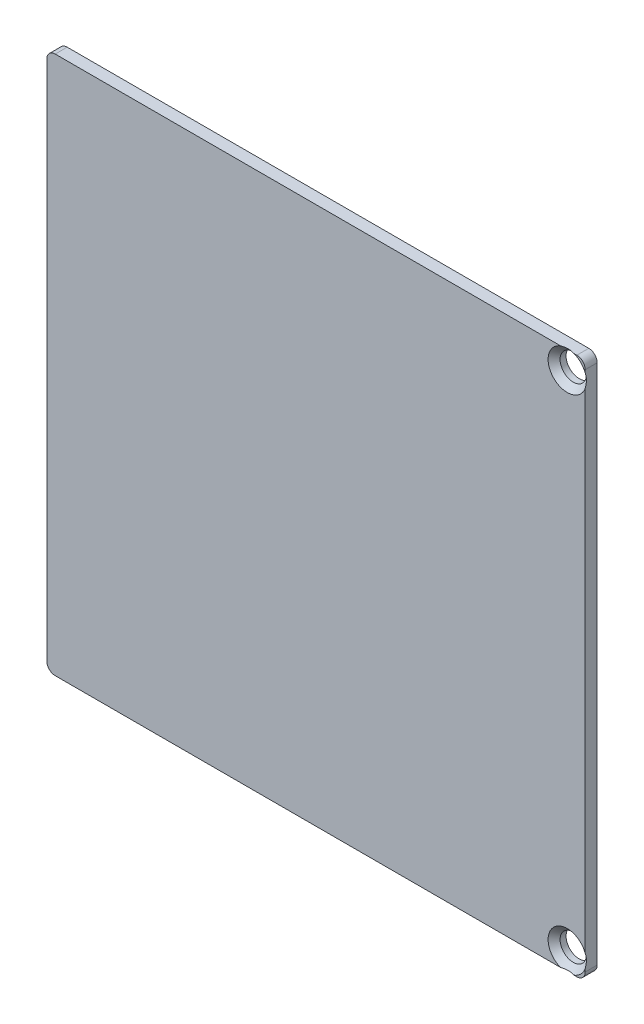
from build123d import *

# Parameters (mm, degrees)
EXTRUDE_1_DEPTH     = 1
SKETCH_2_W          = 2
SKETCH_2_H          = 29
EXTRUDE_2_DEPTH     = 7
SKETCH_3_R          = 1.1
CUT_EXTRUDE_1_DEPTH = 7
SKETCH_4_R          = 0.8
CUT_EXTRUDE_2_DEPTH = 7
CHAMFER_1_SIZE      = 0.5
FILLET_1_R          = 4
CUT_EXTRUDE_3_DEPTH = 10


with BuildPart() as part:
    # 草图1 → 凸台-拉伸1 (new body)
    with BuildSketch(Plane.XY):
        with BuildLine():
            Line((22.5, -21.8), (22.5, 21.8))
            ThreePointArc((22.5, 21.8), (22.294974747, 22.294974747), (21.8, 22.5))
            Line((21.8, 22.5), (-21.8, 22.5))
            ThreePointArc((-21.8, 22.5), (-22.294974747, 22.294974747), (-22.5, 21.8))
            Line((-22.5, 21.8), (-22.5, -21.8))
            ThreePointArc((-22.5, -21.8), (-22.294974747, -22.294974747), (-21.8, -22.5))
            Line((-21.8, -22.5), (21.8, -22.5))
            ThreePointArc((21.8, -22.5), (22.294974747, -22.294974747), (22.5, -21.8))
        make_face()
    extrude(amount=EXTRUDE_1_DEPTH)

    # 草图2 → 凸台-拉伸2 (add)
    with BuildSketch(Plane(origin=(0, 0, 0), x_dir=(-1, 0, 0), z_dir=(0, 0, -1))):
        with Locations((21.5, 0)):
            Rectangle(SKETCH_2_W, SKETCH_2_H)
    extrude(amount=EXTRUDE_2_DEPTH)

    # 草图3 → 切除-拉伸1 (cut)
    with BuildSketch(Plane(origin=(0, 0, 0), x_dir=(-1, 0, 0), z_dir=(0, 0, -1))):
        with Locations((-21, 21)):
            Circle(SKETCH_3_R)
        with Locations((-21, -21)):
            Circle(SKETCH_3_R)
    extrude(amount=-CUT_EXTRUDE_1_DEPTH, mode=Mode.SUBTRACT)

    # 草图4 → 切除-拉伸2 (cut)
    with BuildSketch(Plane.ZY.offset(22.5)):
        with Locations(Location((-3.5, 10, 0), (0, 0, 270))):
            Circle(SKETCH_4_R)
        with Locations(Location((-3.5, -10, 0), (0, 0, 270))):
            Circle(SKETCH_4_R)
    extrude(amount=-CUT_EXTRUDE_2_DEPTH, mode=Mode.SUBTRACT)

    # 倒角1
    # the kernel refuses this chamfer: 0.5 mm, written as the material it takes off along each edge
    with BuildSketch(Plane(origin=(21, 21, 1), x_dir=(-1, 0, 0), z_dir=(0, -1, 0))) as chamfer_1_piece_1:
        Polygon((1.1 + CHAMFER_1_SIZE, 0), (1.1, CHAMFER_1_SIZE), (1.1, 0), align=None)
    revolve(axis=Axis((21, 21, 1), (0, 0, -1)), mode=Mode.SUBTRACT)
    with BuildSketch(Plane(origin=(21, -21, 1), x_dir=(-1, 0, 0), z_dir=(0, -1, 0))) as chamfer_1_piece_2:
        Polygon((1.1 + CHAMFER_1_SIZE, 0), (1.1, CHAMFER_1_SIZE), (1.1, 0), align=None)
    revolve(axis=Axis((21, -21, 1), (0, 0, -1)), mode=Mode.SUBTRACT)

    # 圆角1
    fillet_1_edges = [part.edges().sort_by_distance(p)[0] for p in [
        (-21.5, 14.5, -7),
        (-21.5, -14.5, -7),
    ]]
    fillet(fillet_1_edges, radius=FILLET_1_R)

    # 草图5 → 切除-拉伸3 (cut)
    with BuildSketch(Plane.ZY.offset(22.5)):
        with BuildLine():
            Line((-4.5, 5), (-1.5, 5))
            ThreePointArc((-1.5, 5), (-0.792893219, 4.707106781), (-0.5, 4))
            Line((-0.5, 4), (-0.5, -4))
            ThreePointArc((-0.5, -4), (-0.792893219, -4.707106781), (-1.5, -5))
            Line((-1.5, -5), (-4.5, -5))
            ThreePointArc((-4.5, -5), (-5.207106781, -4.707106781), (-5.5, -4))
            Line((-5.5, -4), (-5.5, 4))
            ThreePointArc((-5.5, 4), (-5.207106781, 4.707106781), (-4.5, 5))
        make_face()
    extrude(amount=-CUT_EXTRUDE_3_DEPTH, mode=Mode.SUBTRACT)


solid = part.part
